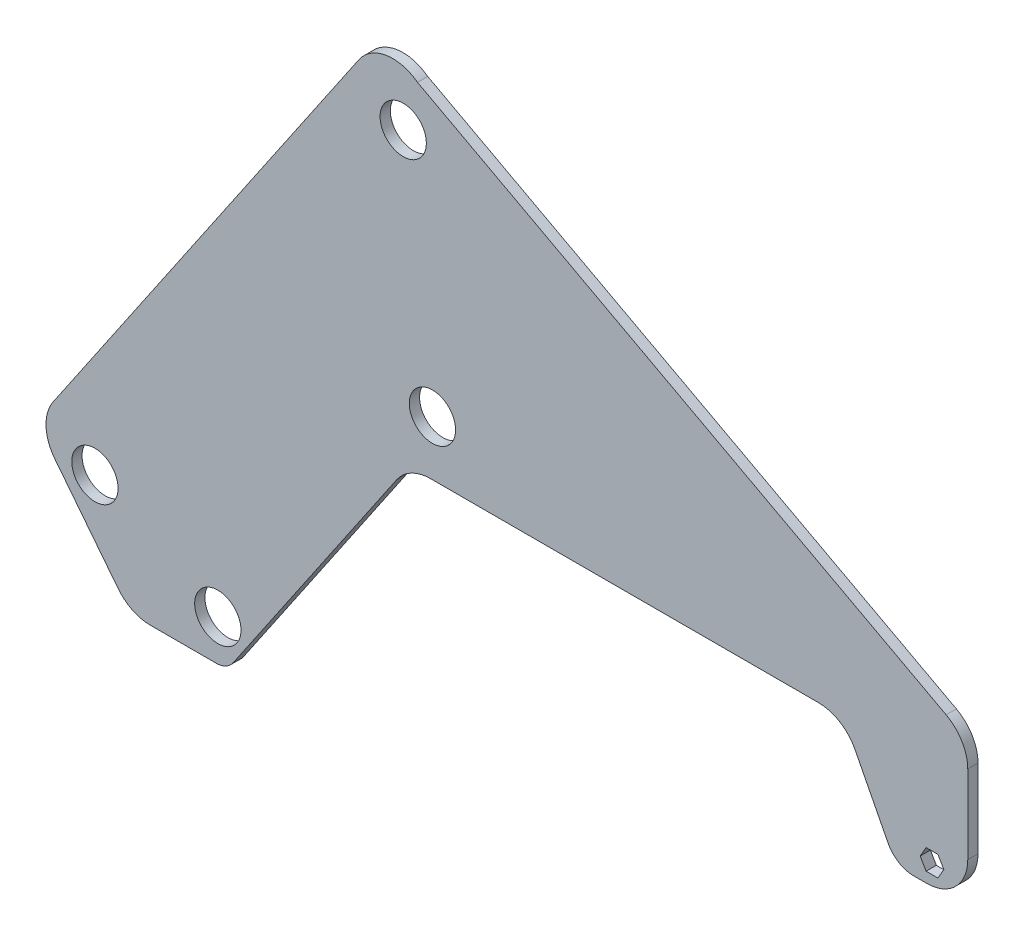
from build123d import *

# Parameters (mm, degrees)
MODEL_R             = 14.351
BOSS_EXTRUDE1_DEPTH = 6.35


with BuildPart() as part:
    # Model → Boss-Extrude1 (new body)
    with BuildSketch(Plane.XY):
        with BuildLine():
            ThreePointArc((-212.899365952, 93.541257838), (-203.778989185, 101.701881024), (-191.901103209, 104.650248016))
            Line((-191.901103209, 104.650248016), (-11.396613492, 104.650248016))
            Line((-11.396613492, 104.650248016), (-2.138802982, 104.650248016))
            Line((-2.138802982, 104.650248016), (48.661197018, 104.650248016))
            ThreePointArc((48.661197018, 104.650248016), (61.901986038, 100.926075708), (71.260020742, 90.8456422))
            Line((71.260020742, 90.8456422), (91.800416921, 50.813472087))
            ThreePointArc((91.800416921, 50.813472087), (98.351041214, 43.757168632), (107.619593528, 41.150248016))
            Line((107.619593528, 41.150248016), (115.808590566, 41.150248016))
            ThreePointArc((115.808590566, 41.150248016), (133.769102808, 48.589735774), (141.208590566, 66.550248016))
            Line((141.208590566, 66.550248016), (141.208590566, 78.884578982))
            Line((141.208590566, 78.884578982), (141.208590566, 115.30333804))
            ThreePointArc((141.208590566, 115.30333804), (137.602779127, 128.348388632), (127.809114585, 137.689660276))
            Line((127.809114585, 137.689660276), (-199.949582693, 313.389629113))
            ThreePointArc((-199.949582693, 313.389629113), (-219.402189514, 318.224062751), (-236.303247901, 307.447705012))
            Line((-236.303247901, 307.447705012), (-425.920878295, 28.83612519))
            ThreePointArc((-425.920878295, 28.83612519), (-430.307847502, 13.679090678), (-424.898106806, -1.14372618))
            Line((-424.898106806, -1.14372618), (-385.58146606, -51.20282143))
            ThreePointArc((-385.58146606, -51.20282143), (-376.71145599, -58.357541068), (-365.605974805, -60.913979882))
            Line((-365.605974805, -60.913979882), (-324.737451002, -60.913979882))
            ThreePointArc((-324.737451002, -60.913979882), (-318.798508014, -59.439796386), (-314.23831963, -55.359484793))
            Line((-314.23831963, -55.359484793), (-212.899365952, 93.541257838))
        make_face()
        with Locations((-323.775189267, -35.513979882)):
            Circle(MODEL_R, mode=Mode.SUBTRACT)
        with Locations((-399.975189267, 2.586020118)):
            Circle(MODEL_R, mode=Mode.SUBTRACT)
        Polygon((122.716975548, 60.200248016), (126.383149757, 53.850248016), (122.716975548, 47.500248016), (115.384627129, 47.500248016), (114.742237203, 48.612900006), (111.71845292, 53.850248016), (115.384627129, 60.200248016), (121.352034814, 60.200248016), align=None, mode=Mode.SUBTRACT)
        with Locations((-190.707148919, 138.516914683)):
            Circle(MODEL_R, mode=Mode.SUBTRACT)
        with Locations((-208.832932893, 283.437784316)):
            Circle(MODEL_R, mode=Mode.SUBTRACT)
    extrude(amount=BOSS_EXTRUDE1_DEPTH)


solid = part.part
